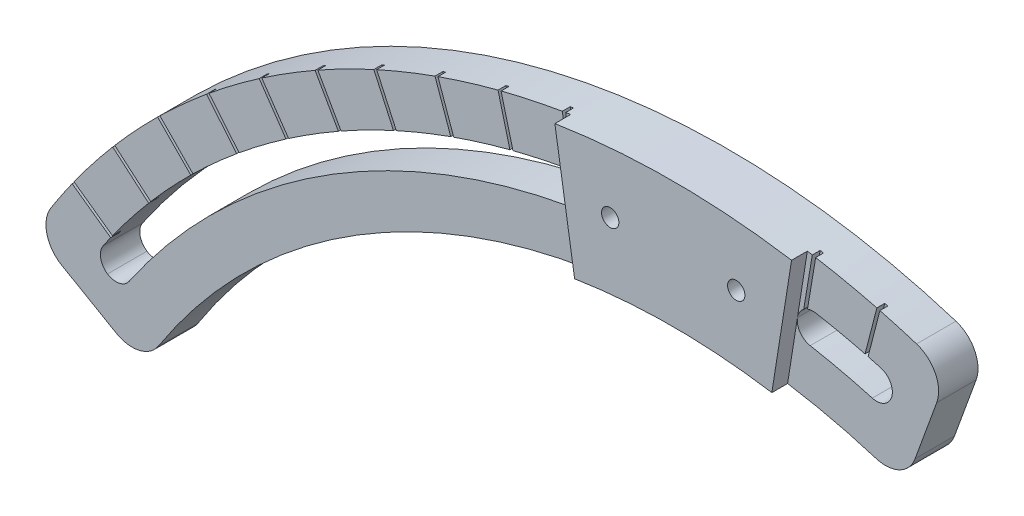
from build123d import *

# Parameters (mm, degrees)
BOSS_EXTRUDE1_DEPTH = 5
SKETCH1_3_R         = 1.1000000000006245
SKETCH1_3_R_2       = 1.1000000000006236
BOSS_EXTRUDE2_DEPTH = 7
SKETCH1_6_R         = 1.1000000000006236
SKETCH1_6_R_2       = 1.1000000000006245
CUT_EXTRUDE3_DEPTH  = 5
FILLET1_R           = 4
FILLET2_R           = 2
CUT_EXTRUDE8_START  = 4
CUT_EXTRUDE8_DEPTH  = 1


with BuildPart() as part:
    # Sketch1 → Boss-Extrude1 (new body)
    with BuildSketch(Plane.XY):
        with BuildLine():
            Line((-83.13843876330769, 48.0000000000023), (-69.28203230275663, 40.00000000000234))
            ThreePointArc((-69.28203230275663, 40.00000000000234), (-27.361611466054974, 75.17540966287518), (27.361611466052146, 75.17540966287518))
            Line((27.361611466052146, 75.17540966287518), (32.833933759262855, 90.21049159544972))
            ThreePointArc((32.833933759262855, 90.21049159544972), (-32.83393375926571, 90.21049159544971), (-83.13843876330769, 48.0000000000023))
        make_face()
    extrude(amount=BOSS_EXTRUDE1_DEPTH)

    # Sketch1<3> → Boss-Extrude2 (add)
    with BuildSketch(Plane.XY):
        with BuildLine():
            Line((-13.453363993461283, 84.94119729118435), (-12.514757203219895, 79.01506724761352))
            ThreePointArc((-12.514757203219894, 79.01506724761353), (-1.39977e-12, 80.00000000000253), (12.514757203217084, 79.01506724761356))
            Line((12.514757203217078, 79.01506724761352), (13.453363993458465, 84.94119729118435))
            Line((13.453363993458465, 84.94119729118435), (14.079101853619393, 88.89195065356492))
            Line((14.079101853619393, 88.89195065356492), (15.017708643860779, 94.81808069713574))
            ThreePointArc((15.017708643860784, 94.81808069713577), (-1.40067e-12, 96.00000000000256), (-15.017708643863598, 94.81808069713577))
            Line((-15.017708643863596, 94.81808069713574), (-14.07910185362221, 88.89195065356492))
            Line((-14.07910185362221, 88.89195065356492), (-13.453363993461283, 84.94119729118435))
        make_face()
        with Locations(Location((-8.000000000001409, 88.00000000000252, 0), (0, 0, 180))):
            Circle(SKETCH1_3_R, mode=Mode.SUBTRACT)
        with Locations((7.999999999998591, 88.00000000000252)):
            Circle(SKETCH1_3_R_2, mode=Mode.SUBTRACT)
    extrude(amount=BOSS_EXTRUDE2_DEPTH)

    # Sketch1<6> → Cut-Extrude3 (cut)
    with BuildSketch(Plane.XY):
        with BuildLine():
            Line((-75.48035111508972, 49.01751315135477), (-72.125668843308, 46.83895701129465))
            ThreePointArc((-72.12566884330799, 46.83895701129467), (-46.83895701129383, 72.12566884330892), (-13.453363993461279, 84.94119729118435))
            Line((-13.453363993461283, 84.94119729118435), (-14.07910185362221, 88.89195065356492))
            ThreePointArc((-14.079101853622205, 88.89195065356492), (-49.01751315135395, 75.4803511150906), (-75.48035111508973, 49.01751315135477))
        make_face()
        with BuildLine():
            Line((14.079101853619393, 88.89195065356492), (13.453363993458465, 84.94119729118435))
            ThreePointArc((13.453363993458456, 84.94119729118435), (19.345790673570992, 83.79582557153273), (25.14396660615395, 82.24220901282357))
            Line((25.143966606153956, 82.24220901282357), (26.31345342504491, 86.06742803667572))
            ThreePointArc((26.31345342504492, 86.06742803667575), (20.245594890946464, 87.69330583067372), (14.079101853619395, 88.89195065356492))
        make_face()
        with Locations((7.999999999998591, 88.00000000000252)):
            Circle(SKETCH1_6_R)
        with Locations(Location((-8.000000000001409, 88.00000000000252, 0), (0, 0, 180))):
            Circle(SKETCH1_6_R_2)
    extrude(amount=CUT_EXTRUDE3_DEPTH, mode=Mode.SUBTRACT)

    # Fillet1
    fillet1_edges = [part.edges().sort_by_distance(p)[0] for p in [
        (27.361611466052143, 75.17540966287518, 2.5),
        (-69.28203230275663, 40.000000000002345, 2.5),
        (-83.1384387633077, 48.0000000000023, 2.5),
        (32.83393375926286, 90.21049159544972, 2.5),
    ]]
    fillet(fillet1_edges, radius=FILLET1_R)

    # Fillet2
    fillet2_edges = [part.edges().sort_by_distance(p)[0] for p in [
        (13.45336399345846, 84.94119729118435, 2.5),
        (14.079101853619393, 88.89195065356492, 2.5),
        (-13.45336399346129, 84.94119729118435, 2.5),
        (-14.079101853622209, 88.89195065356492, 2.5),
        (-72.125668843308, 46.83895701129467, 2.5),
        (-75.48035111508975, 49.01751315135476, 2.5),
        (26.313453425044912, 86.06742803667574, 2.5),
        (25.143966606153953, 82.24220901282357, 2.5),
    ]]
    fillet(fillet2_edges, radius=FILLET2_R - 0.0001)  # a hair under: the kernel refuses the full size

    # Sketch1<11> → Cut-Extrude8 (cut)
    with BuildSketch(Plane.XY.offset(CUT_EXTRUDE8_START)):
        with BuildLine():
            ThreePointArc((-60.90905171355247, 74.20301489398085), (-61.063509146668466, 74.07596000522229), (-61.21770154690506, 73.9485836058718))
            Line((-61.21770154690517, 73.9485836058717), (-57.40122339078805, 69.31882538850002))
            ThreePointArc((-57.40122339078971, 69.31882538849865), (-57.247039825001984, 69.44621250489581), (-57.092573557434, 69.5732566766103))
            Line((-57.09257355743297, 69.57325667661115), (-60.909051713550085, 74.20301489398283))
        make_face()
        with BuildLine():
            ThreePointArc((-67.14449326003556, 68.61207637765807), (-67.28728937278758, 68.47204311880354), (-67.42979343969591, 68.33171267193941))
            Line((-67.42979343969681, 68.33171267193853), (-63.22432811901289, 64.05220007072279))
            ThreePointArc((-63.22432811901119, 64.05220007072444), (-63.081833786988334, 64.19254042387854), (-62.939027939352314, 64.33256377644165))
            Line((-62.93902793935119, 64.33256377644273), (-67.14449326003512, 68.61207637765848))
        make_face()
        with BuildLine():
            ThreePointArc((-72.86892466985591, 62.49895853099788), (-72.9989726976045, 62.34701263970007), (-73.12870388919032, 62.19479614475513))
            Line((-73.12870388918984, 62.19479614475569), (-68.5662575343589, 58.298098834631475))
            ThreePointArc((-68.56625753435887, 58.298098834631524), (-68.43653690400481, 58.45032434971835), (-68.30647831502658, 58.60226122087179))
            Line((-68.30647831502684, 58.60226122087151), (-72.86892466985778, 62.498958530995715))
        make_face()
        with BuildLine():
            Line((16.639553027860302, 100.6343880514797), (14.331087155641026, 86.8395399557962))
            ThreePointArc((14.331087155641026, 86.8395399557962), (14.54451947105813, 86.80404778668378), (14.757863892002872, 86.76803104912538))
            Line((14.757863892002872, 86.76803104912538), (17.066344573354787, 100.56296764072263))
            Line((17.066344573354787, 100.56296764072263), (16.639553027860302, 100.6343880514797))
        make_face()
        with BuildLine():
            Line((25.73337251273005, 98.70106424012083), (22.231449806724747, 85.16013385550725))
            ThreePointArc((22.231449806724747, 85.16013385550725), (22.037877706171837, 85.21043190246515), (21.844191809986345, 85.26028995356089))
            Line((21.844191809986345, 85.26028995356089), (25.34611345657903, 98.80121624174181))
            Line((25.34611345657903, 98.80121624174181), (25.73337251273005, 98.70106424012083))
        make_face()
        with BuildLine():
            Line((42.116005821693015, 92.89966951845646), (36.3159273051723, 80.17255878891613))
            ThreePointArc((36.3159273051723, 80.17255878891613), (36.49801466794809, 80.08982884296243), (36.67991356817236, 80.00668534208985))
            Line((36.67991356817236, 80.00668534208985), (42.47999033003967, 92.733792221395))
            Line((42.47999033003967, 92.733792221395), (42.116005821693015, 92.89966951845646))
        make_face()
        with BuildLine():
            Line((-16.639553027863123, 100.6343880514797), (-14.331087155646365, 86.83953995579603))
            ThreePointArc((-14.331087155646365, 86.83953995579603), (-14.544519471062088, 86.80404778668402), (-14.757863892005375, 86.76803104912547))
            Line((-14.757863892005375, 86.76803104912547), (-17.066344573355888, 100.56296764072306))
            Line((-17.066344573355888, 100.56296764072306), (-16.639553027863123, 100.6343880514797))
        make_face()
        with BuildLine():
            Line((-25.346113456581847, 98.80121624174181), (-21.8441918099951, 85.26028995355922))
            ThreePointArc((-21.8441918099951, 85.26028995355922), (-22.03787770624786, 85.21043190244556), (-22.231449806868046, 85.16013385546994))
            Line((-22.231449806868046, 85.16013385546994), (-25.733372512730377, 98.70106424012063))
            Line((-25.733372512730377, 98.70106424012063), (-25.346113456581847, 98.80121624174181))
        make_face()
        with BuildLine():
            Line((-34.251374684060885, 96.12374945737389), (-29.568170243810847, 82.89878809264937))
            ThreePointArc((-29.568170243810847, 82.89878809264937), (-29.379717798712498, 82.96576366709935), (-29.191113647373975, 83.03231083634289))
            Line((-29.191113647373975, 83.03231083634289), (-33.87431808762401, 96.25727220106741))
            Line((-33.87431808762401, 96.25727220106741), (-34.251374684060885, 96.12374945737389))
        make_face()
        with BuildLine():
            Line((-42.47999033004247, 92.73379222139498), (-36.67991356817387, 80.00668534209034))
            ThreePointArc((-36.67991356817387, 80.00668534209034), (-36.49801466794875, 80.0898288429634), (-36.31592730517207, 80.1725587889175))
            Line((-36.31592730517207, 80.1725587889175), (-42.11600582169416, 92.89966951845659))
            Line((-42.11600582169416, 92.89966951845659), (-42.47999033004247, 92.73379222139498))
        make_face()
        with BuildLine():
            Line((-50.40062368063963, 88.67853703576704), (-43.51337750884637, 76.50537063873087))
            ThreePointArc((-43.51337750884637, 76.50537063873087), (-43.33941722242662, 76.6040512872355), (-43.16523314692608, 76.70233638011615))
            Line((-43.16523314692608, 76.70233638011615), (-50.052481402265904, 88.87550645980734))
            Line((-50.052481402265904, 88.87550645980734), (-50.40062368063963, 88.67853703576704))
        make_face()
        with BuildLine():
            Line((-57.937677852298485, 83.94838463773227), (-50.01567837258084, 72.42180386960484))
            ThreePointArc((-50.01567837258084, 72.42180386960484), (-49.850980642786205, 72.53527064642093), (-49.68602550055159, 72.64836287732517))
            Line((-49.68602550055159, 72.64836287732517), (-57.6080273768518, 84.17494713250092))
            Line((-57.6080273768518, 84.17494713250092), (-57.937677852298485, 83.94838463773227))
        make_face()
        with BuildLine():
            Line((-82.9591200723337, 59.41983064866502), (-71.53733737082064, 51.27275222465001))
            ThreePointArc((-71.53733737082064, 51.27275222465001), (-71.653662958767, 51.11006107791678), (-71.769618553105, 50.94710601730748))
            Line((-71.769618553105, 50.94710601730748), (-83.19140125461807, 59.09418444132249))
            Line((-83.19140125461807, 59.09418444132249), (-82.9591200723337, 59.41983064866502))
        make_face()
    extrude(amount=CUT_EXTRUDE8_DEPTH, mode=Mode.SUBTRACT)


solid = part.part
